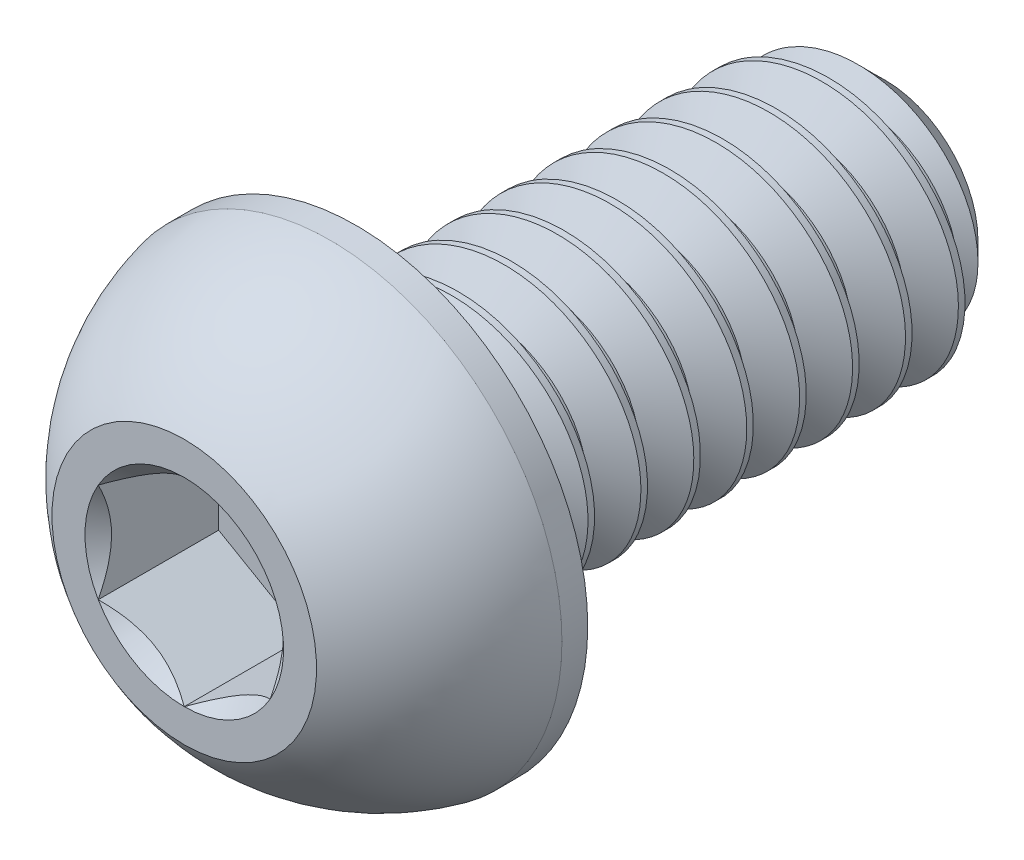
from build123d import *

# Parameters (mm, degrees)
SKETCH1_W          = 4
SKETCH1_H          = 1
CHAMFER1_SIZE      = 0.3
CUT_SWEEP1_PITCH   = 0.4
CUT_EXTRUDE2_DEPTH = 0.91


with BuildPart() as part:
    # Sketch1 → Revolve1 (revolve)
    with BuildSketch(Plane(origin=(0, 0, 0), x_dir=(0, 0, -1), z_dir=(1, 0, 0))):
        with Locations((3.3, 0.5)):
            Rectangle(SKETCH1_W, SKETCH1_H)
    revolve(axis=Axis((0, 0, -5.3), (0, 0, 1)))

    # Chamfer1
    chamfer1_edges = [part.edges().sort_by_distance(p)[0] for p in [
        (0, -1, -5.3),
    ]]
    chamfer(chamfer1_edges, length=CHAMFER1_SIZE)

    # Cut-Sweep1: arcs per turn and ends read off the stored shape
    # Cut-Sweep1: the profile of Sketch2 profile screwed along a right-hand helix through 11 turns, 6 arcs to a turn; built about Z, then put on its axis
    cut_sweep1_z = Axis((0, 0, 0), (0, 0, 1))
    cut_sweep1_corners = [(1.0003, 0, 0.000173224), (1.0003, 0, -0.350173186), (0.740192379, 0, -0.199999981), (0.740192379, 0, -0.149999981)]
    with BuildLine(mode=Mode.PRIVATE) as cut_sweep1_profile:
        Line(cut_sweep1_corners[0], cut_sweep1_corners[1])
        Line(cut_sweep1_corners[1], cut_sweep1_corners[2])
        Line(cut_sweep1_corners[2], cut_sweep1_corners[3])
        Line(cut_sweep1_corners[3], cut_sweep1_corners[0])
    cut_sweep1_cap = Face(cut_sweep1_profile.wire())
    cut_sweep1_turn_angles = [0, 30, 60, 90, 120, 150, 180, 210, 240, 270, 300, 330, 360]
    cut_sweep1_turn_weights = [1, 0.8660254037844387, 1, 0.8660254037844387, 1, 0.8660254037844387, 1, 0.8660254037844387, 1, 0.8660254037844387, 1, 0.8660254037844387, 1]
    cut_sweep1_turn_rails = [Edge.make_bspline([Vector(p[0], p[1], 0).rotate(cut_sweep1_z, cut_sweep1_turn_angles[k]) / cut_sweep1_turn_weights[k] + Vector(0, 0, p[2] + CUT_SWEEP1_PITCH * cut_sweep1_turn_angles[k] / 360) for k in range(13)], [0, 0, 0, 1, 1, 2, 2, 3, 3, 4, 4, 5, 5, 6, 6, 6], 2, cut_sweep1_turn_weights) for p in cut_sweep1_corners]
    cut_sweep1_turn_sides = [Face.make_surface_from_curves(cut_sweep1_turn_rails[p[0]], cut_sweep1_turn_rails[p[1]]) for p in [(0, 1), (1, 2), (2, 3), (3, 0)]]
    cut_sweep1 = Plane(origin=(0, 0, -5.3), x_dir=(1, 0, 0), z_dir=(0, 0, 1)) * Solid(Shell([*[p.moved(Location((0, 0, CUT_SWEEP1_PITCH * i))) for i in range(11) for p in cut_sweep1_turn_sides], cut_sweep1_cap, cut_sweep1_cap.rotate(cut_sweep1_z, 3960).moved(Location((0, 0, CUT_SWEEP1_PITCH * 3960 / 360)))]))
    add(cut_sweep1, mode=Mode.SUBTRACT)

    # Sketch7 → Revolve2 (revolve)
    with BuildSketch(Plane(origin=(0, 0, 0), x_dir=(0, 0, -1), z_dir=(1, 0, 0)), mode=Mode.PRIVATE) as revolve2_sk:
        with BuildLine():
            Line((1.105, 1.75), (1.3, 1.75))
            Line((1.3, 1.75), (1.3, 0))
            Line((1.3, 0), (0, 0))
            Line((0, 0), (0, 1))
            ThreePointArc((0, 1), (0.479976957, 1.481850617), (1.105, 1.75))
        make_face()
    revolve(revolve2_sk.sketch.rotate(Axis((0, 0, 0), (0, 0, -1)), 180), axis=Axis((0, 0, 0), (0, 0, -1)))

    # Sketch5 → Cut-Extrude2 (cut)
    with BuildSketch(Plane.XY):
        Polygon((0.65, -0.375277675), (0.65, 0.375277675), (0, 0.75055535), (-0.65, 0.375277675), (-0.65, -0.375277675), (0, -0.75055535), align=None)
    extrude(amount=-CUT_EXTRUDE2_DEPTH, mode=Mode.SUBTRACT)

    # Cut-Extrude3 cone 1 section (through the dimple's axis) → Cut-Extrude3 (revolve, cut)
    with BuildSketch(Plane(origin=(0, 0, 0), x_dir=(0, -1, 0), z_dir=(1, 0, 0))):
        Polygon((0, 0), (0.75055535, 0), (0, 0.75055535), align=None)
    revolve(axis=Axis((0, 0, 0), (0, 0, -1)), mode=Mode.SUBTRACT)


solid = part.part
